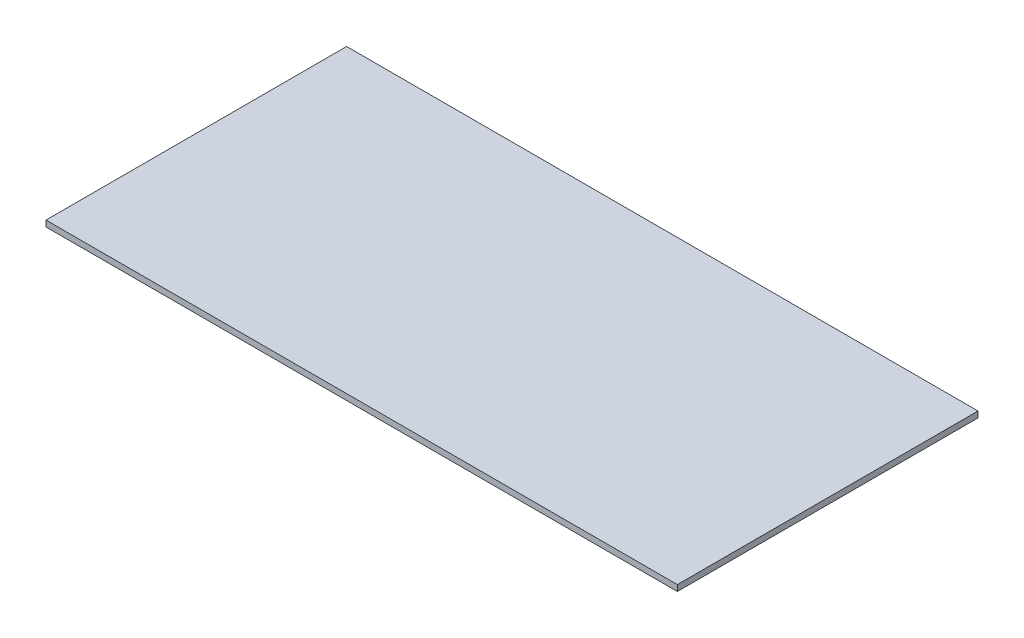
from build123d import *

# Parameters (mm, degrees)
SKETCH_1_W      = 210
SKETCH_1_H      = 100
EXTRUDE_1_DEPTH = 2


with BuildPart() as part:
    # Эскиз1 → Бобышка-Вытянуть1 (new body)
    with BuildSketch(Plane(origin=(0, 0, 0), x_dir=(1, 0, 0), z_dir=(0, 1, 0))):
        with Locations((105, 50)):
            Rectangle(SKETCH_1_W, SKETCH_1_H)
    extrude(amount=EXTRUDE_1_DEPTH)


solid = part.part
